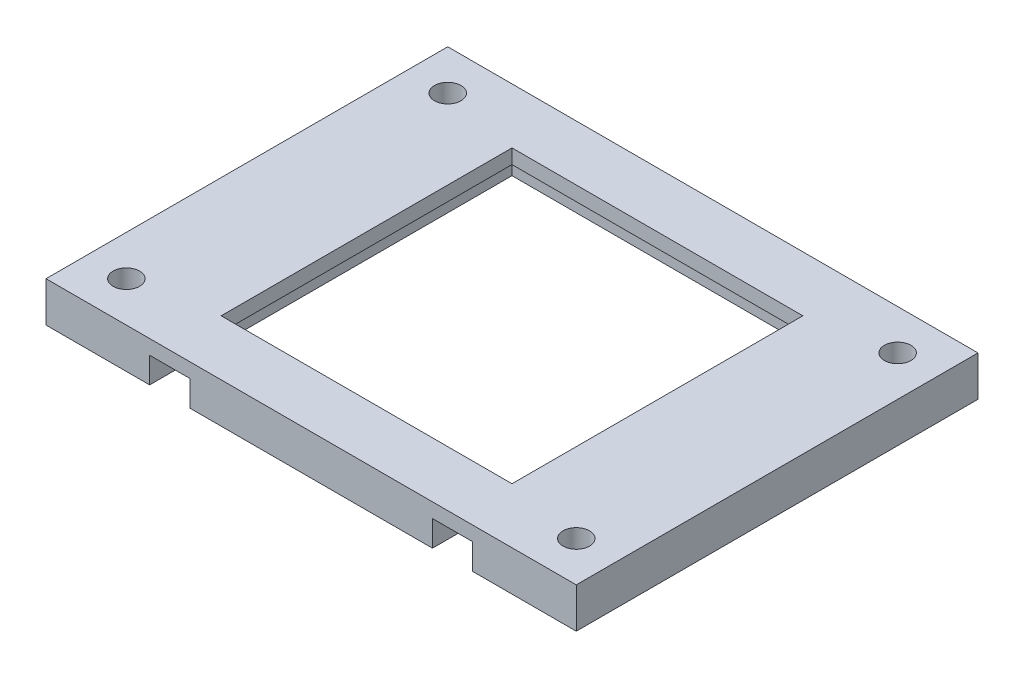
from build123d import *

# Parameters (mm, degrees)
SKETCH1_W           = 66
SKETCH1_H           = 50
SKETCH1_R           = 1.65
SKETCH1_W_2         = 40.2
SKETCH1_H_2         = 40.2
BOSS_EXTRUDE1_DEPTH = 5
SKETCH2_W           = 40.2
SKETCH2_H           = 40.2
SKETCH2_W_2         = 36.2
SKETCH2_H_2         = 36.2
BOSS_EXTRUDE2_DEPTH = 1.8
CUT_EXTRUDE1_REACH  = 62.117
SKETCH3_W           = 5
SKETCH3_H           = 3.2


with BuildPart() as part:
    # Sketch1 → Boss-Extrude1 (new body)
    with BuildSketch(Plane(origin=(0, 0, 0), x_dir=(1, 0, 0), z_dir=(0, 1, 0))):
        Rectangle(SKETCH1_W, SKETCH1_H)
        with Locations((-28, 20)):
            Circle(SKETCH1_R, mode=Mode.SUBTRACT)
        with Locations((28, 20)):
            Circle(SKETCH1_R, mode=Mode.SUBTRACT)
        with Locations((-28, -20)):
            Circle(SKETCH1_R, mode=Mode.SUBTRACT)
        with Locations((28, -20)):
            Circle(SKETCH1_R, mode=Mode.SUBTRACT)
        Rectangle(SKETCH1_W_2, SKETCH1_H_2, mode=Mode.SUBTRACT)
    extrude(amount=BOSS_EXTRUDE1_DEPTH)

    # Sketch2 → Boss-Extrude2 (add)
    with BuildSketch(Plane(origin=(0, 5, 0), x_dir=(1, 0, 0), z_dir=(0, 1, 0))):
        Rectangle(SKETCH2_W, SKETCH2_H)
        Rectangle(SKETCH2_W_2, SKETCH2_H_2, mode=Mode.SUBTRACT)
    extrude(amount=-BOSS_EXTRUDE2_DEPTH)

    # Sketch3 → Cut-Extrude1 (cut, up to next)
    with BuildSketch(Plane.XY.offset(25), mode=Mode.PRIVATE) as cut_extrude1_sk1:
        with Locations((-17.6, 1.6)):
            Rectangle(SKETCH3_W, SKETCH3_H)
    cut_extrude1_tool1 = extrude(cut_extrude1_sk1.sketch, amount=-CUT_EXTRUDE1_REACH, mode=Mode.PRIVATE) & part.part
    # Sketch3 → Cut-Extrude1 (cut, up to next)
    with BuildSketch(Plane.XY.offset(25), mode=Mode.PRIVATE) as cut_extrude1_sk2:
        with Locations((17.6, 1.6)):
            Rectangle(SKETCH3_W, SKETCH3_H)
    cut_extrude1_tool2 = extrude(cut_extrude1_sk2.sketch, amount=-CUT_EXTRUDE1_REACH, mode=Mode.PRIVATE) & part.part
    add(cut_extrude1_tool1.solids().sort_by_distance((-17.6, 1.6, 25))[0], mode=Mode.SUBTRACT)
    add(cut_extrude1_tool2.solids().sort_by_distance((17.6, 1.6, 25))[0], mode=Mode.SUBTRACT)


solid = part.part
